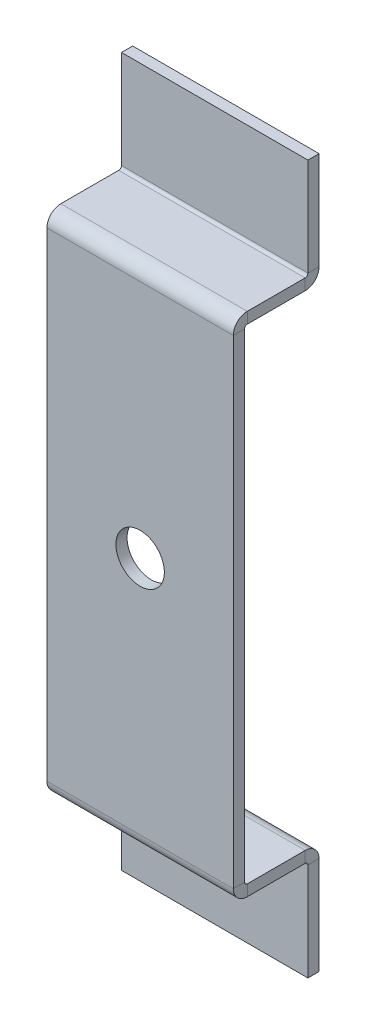
from build123d import *

# Parameters (mm, degrees)
SKETCH_1_W                         = 50
SKETCH_1_H                         = 130
SM_BASE_FLANGE_1_DEPTH             = 3
SM_EDGE_FLANGE_1_STRIP_W           = 13.4732
SM_EDGE_FLANGE_1_STRIP_H           = 3
SM_EDGE_FLANGE_1_STRIP_CUT_DEPTH   = 50
SM_EDGE_FLANGE_1_STRIP_2_W         = 13.4732
SM_EDGE_FLANGE_1_STRIP_2_H         = 3
SM_EDGE_FLANGE_1_STRIP_CUT_2_DEPTH = 50
SM_EDGE_FLANGE_1_DEPTH             = 50
SM_EDGE_FLANGE_1_BEND_DEPTH        = 50
SM_EDGE_FLANGE_2_STRIP_W           = 13.4732
SM_EDGE_FLANGE_2_STRIP_H           = 3
SM_EDGE_FLANGE_2_STRIP_CUT_DEPTH   = 50
SM_EDGE_FLANGE_2_STRIP_2_W         = 13.4732
SM_EDGE_FLANGE_2_STRIP_2_H         = 3
SM_EDGE_FLANGE_2_STRIP_CUT_2_DEPTH = 50
SM_EDGE_FLANGE_2_DEPTH             = 50
SM_EDGE_FLANGE_2_BEND_DEPTH        = 50
SKETCH_18_R                        = 6.5
CUT_EXTRUDE_1_DEPTH                = 170.201063826


# Sheet-metal steps are written as plain solids
with BuildPart() as part:
    # Sketch 1 → 基体-法兰1 (new body)
    with BuildSketch(Plane.XY):
        with Locations((25, 65)):
            Rectangle(SKETCH_1_W, SKETCH_1_H)
    extrude(amount=-SM_BASE_FLANGE_1_DEPTH)

    # 边线-法兰1 strip (across the edge) → 边线-法兰1 strip cut (cut)
    with BuildSketch(Plane(origin=(0, 130, -3), x_dir=(0, -1, 0), z_dir=(1, 0, 0))):
        with Locations((-6, -1.5)):
            Rectangle(SM_EDGE_FLANGE_1_STRIP_W, SM_EDGE_FLANGE_1_STRIP_H)
    extrude(amount=SM_EDGE_FLANGE_1_STRIP_CUT_DEPTH, mode=Mode.SUBTRACT)

    # 边线-法兰1 strip 2 (across the edge) → 边线-法兰1 strip cut 2 (cut)
    with BuildSketch(Plane(origin=(50, 0, -3), x_dir=(0, 1, 0), z_dir=(-1, 0, 0))):
        with Locations((-6, -1.5)):
            Rectangle(SM_EDGE_FLANGE_1_STRIP_2_W, SM_EDGE_FLANGE_1_STRIP_2_H)
    extrude(amount=SM_EDGE_FLANGE_1_STRIP_CUT_2_DEPTH, mode=Mode.SUBTRACT)

    # 边线-法兰1 section (across the edge) → 边线-法兰1 (add)
    with BuildSketch(Plane(origin=(0, 130, -3), x_dir=(0, -1, 0), z_dir=(1, 0, 0))):
        with BuildLine():
            Line((-3, 0.7366), (-3, 17))
            Line((-3, 17), (0, 17))
            Line((0, 17), (0, 0.7366))
            ThreePointArc((0, 0.7366), (0.215745145, 0.215745145), (0.7366, 0))
            Line((0.7366, 0), (0.7366, -3))
            ThreePointArc((0.7366, -3), (-1.905575199, -1.905575199), (-3, 0.7366))
        make_face()
    extrude(amount=SM_EDGE_FLANGE_1_DEPTH)

    # 边线-法兰1 section 2 (across the edge) → 边线-法兰1 bend (add)
    with BuildSketch(Plane(origin=(50, 0, -3), x_dir=(0, 1, 0), z_dir=(-1, 0, 0))):
        with BuildLine():
            Line((-3, 0.7366), (-3, 17))
            Line((-3, 17), (0, 17))
            Line((0, 17), (0, 0.7366))
            ThreePointArc((0, 0.7366), (0.215745145, 0.215745145), (0.7366, 0))
            Line((0.7366, 0), (0.7366, -3))
            ThreePointArc((0.7366, -3), (-1.905575199, -1.905575199), (-3, 0.7366))
        make_face()
    extrude(amount=SM_EDGE_FLANGE_1_BEND_DEPTH)

    # 边线-法兰2 strip (across the edge) → 边线-法兰2 strip cut (cut)
    with BuildSketch(Plane(origin=(0, -3, -20), x_dir=(0, 0, 1), z_dir=(1, 0, 0))):
        with Locations((-6, -1.5)):
            Rectangle(SM_EDGE_FLANGE_2_STRIP_W, SM_EDGE_FLANGE_2_STRIP_H)
    extrude(amount=SM_EDGE_FLANGE_2_STRIP_CUT_DEPTH, mode=Mode.SUBTRACT)

    # 边线-法兰2 strip 2 (across the edge) → 边线-法兰2 strip cut 2 (cut)
    with BuildSketch(Plane(origin=(50, 133, -20), x_dir=(0, 0, 1), z_dir=(-1, 0, 0))):
        with Locations((-6, -1.5)):
            Rectangle(SM_EDGE_FLANGE_2_STRIP_2_W, SM_EDGE_FLANGE_2_STRIP_2_H)
    extrude(amount=SM_EDGE_FLANGE_2_STRIP_CUT_2_DEPTH, mode=Mode.SUBTRACT)

    # 边线-法兰2 section (across the edge) → 边线-法兰2 (add)
    with BuildSketch(Plane(origin=(0, -3, -20), x_dir=(0, 0, 1), z_dir=(1, 0, 0))):
        with BuildLine():
            Line((-3, 0.7366), (-3, 27))
            Line((-3, 27), (0, 27))
            Line((0, 27), (0, 0.7366))
            ThreePointArc((0, 0.7366), (0.215745145, 0.215745145), (0.7366, 0))
            Line((0.7366, 0), (0.7366, -3))
            ThreePointArc((0.7366, -3), (-1.905575199, -1.905575199), (-3, 0.7366))
        make_face()
    extrude(amount=SM_EDGE_FLANGE_2_DEPTH)

    # 边线-法兰2 section 2 (across the edge) → 边线-法兰2 bend (add)
    with BuildSketch(Plane(origin=(50, 133, -20), x_dir=(0, 0, 1), z_dir=(-1, 0, 0))):
        with BuildLine():
            Line((-3, 0.7366), (-3, 27))
            Line((-3, 27), (0, 27))
            Line((0, 27), (0, 0.7366))
            ThreePointArc((0, 0.7366), (0.215745145, 0.215745145), (0.7366, 0))
            Line((0.7366, 0), (0.7366, -3))
            ThreePointArc((0.7366, -3), (-1.905575199, -1.905575199), (-3, 0.7366))
        make_face()
    extrude(amount=SM_EDGE_FLANGE_2_BEND_DEPTH)

    # 草图18 → 切除-拉伸1 (cut, through all)
    with BuildSketch(Plane.XY):
        with Locations((25, 65)):
            Circle(SKETCH_18_R)
    extrude(amount=-CUT_EXTRUDE_1_DEPTH, mode=Mode.SUBTRACT)


solid = part.part
